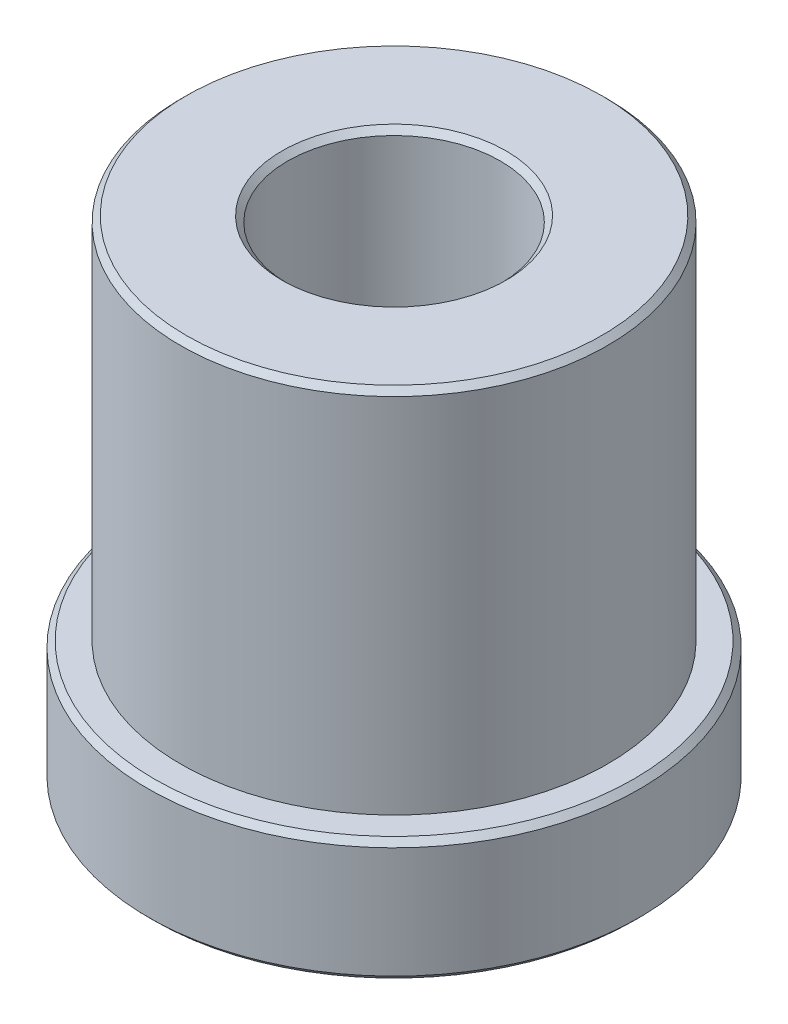
from build123d import *

# Parameters (mm, degrees)
SKETCH1_R           = 11.049
BOSS_EXTRUDE1_DEPTH = 19.05
SKETCH2_R           = 12.7
BOSS_EXTRUDE2_DEPTH = 6.35
SKETCH3_R           = 5.5
CUT_EXTRUDE1_DEPTH  = 32.108519733
SKETCH4_R           = 11.1125
CUT_EXTRUDE2_DEPTH  = 5.5372
CHAMFER1_SIZE       = 0.299999908


with BuildPart() as part:
    # Sketch1 → Boss-Extrude1 (new body)
    with BuildSketch(Plane(origin=(0, 0, 0), x_dir=(1, 0, 0), z_dir=(0, 1, 0))):
        Circle(SKETCH1_R)
    extrude(amount=BOSS_EXTRUDE1_DEPTH)

    # Sketch2 → Boss-Extrude2 (add)
    with BuildSketch(Plane.XZ):
        Circle(SKETCH2_R)
    extrude(amount=BOSS_EXTRUDE2_DEPTH)

    # Sketch3 → Cut-Extrude1 (cut, through all)
    with BuildSketch(Plane.XZ.offset(6.35)):
        Circle(SKETCH3_R)
    extrude(amount=-CUT_EXTRUDE1_DEPTH, mode=Mode.SUBTRACT)

    # Sketch4 → Cut-Extrude2 (cut)
    with BuildSketch(Plane.XZ.offset(6.35)):
        Circle(SKETCH4_R)
    extrude(amount=-CUT_EXTRUDE2_DEPTH, mode=Mode.SUBTRACT)

    # Chamfer1
    chamfer1_edges = [part.edges().sort_by_distance(p)[0] for p in [
        (-5.5, -0.8128, 0),
        (-12.7, 0, 0),
        (-12.7, -6.35, 0),
        (-11.1125, -6.35, 0),
        (-11.049, 19.05, 0),
        (-5.5, 19.05, 0),
    ]]
    chamfer(chamfer1_edges, length=CHAMFER1_SIZE)


solid = part.part
